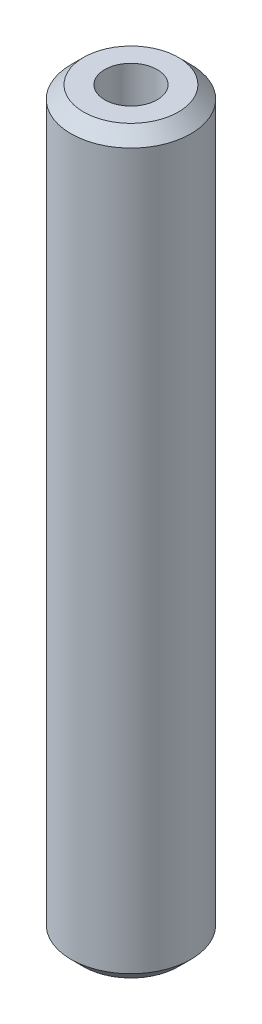
from build123d import *

# Parameters (mm, degrees)
SKETCH1_R           = 10
BOSS_EXTRUDE1_DEPTH = 123.483005153
SKETCH2_R           = 4.376141483
CUT_EXTRUDE1_DEPTH  = 125.290194954
CHAMFER1_SIZE       = 2.096837917


with BuildPart() as part:
    # Sketch1 → Boss-Extrude1 (new body)
    with BuildSketch(Plane(origin=(0, 0, 0), x_dir=(1, 0, 0), z_dir=(0, 1, 0))):
        Circle(SKETCH1_R)
    extrude(amount=BOSS_EXTRUDE1_DEPTH)

    # Sketch2 → Cut-Extrude1 (cut, through all)
    with BuildSketch(Plane(origin=(0, 0, 0), x_dir=(1, 0, 0), z_dir=(0, 1, 0))):
        Circle(SKETCH2_R)
    extrude(amount=CUT_EXTRUDE1_DEPTH, mode=Mode.SUBTRACT)

    # Chamfer1
    chamfer1_edges = [part.edges().sort_by_distance(p)[0] for p in [
        (-10, 123.483005153, 0),
        (-10, 0, 0),
    ]]
    chamfer(chamfer1_edges, length=CHAMFER1_SIZE)


solid = part.part
